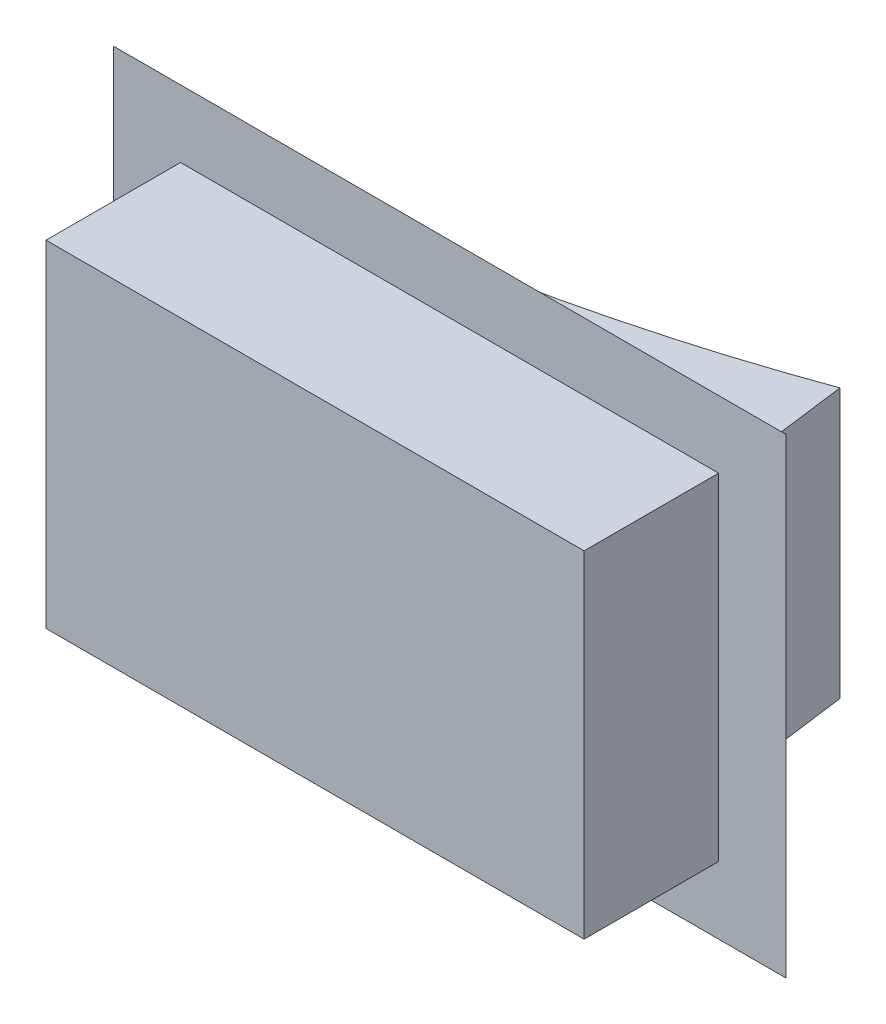
from build123d import *

# Parameters (mm, degrees)
SKETCH1_W           = 20
SKETCH1_H           = 14
BOSS_EXTRUDE1_DEPTH = 2
CHAMFER3_SIZE       = 2
SKETCH2_W           = 14
SKETCH2_H           = 8
BOSS_EXTRUDE2_DEPTH = 3
CUT_EXTRUDE1_DEPTH  = 16.165750888
SKETCH5_W           = 16
SKETCH5_H           = 10
BOSS_EXTRUDE3_DEPTH = 4
SKETCH6_R           = 2.017871448
SKETCH6_R_2         = 1.817871448
SKETCH6_W           = 4.259238865
SKETCH6_H           = 0.3
CUT_EXTRUDE2_DEPTH  = 1.5


with BuildPart() as part:
    # Sketch1 → Boss-Extrude1 (new body)
    with BuildSketch(Plane.XY):
        Rectangle(SKETCH1_W, SKETCH1_H)
    extrude(amount=BOSS_EXTRUDE1_DEPTH)

    # Chamfer3
    chamfer3_edges = [part.edges().sort_by_distance(p)[0] for p in [
        (-10, 0, 0),
        (0, -7, 0),
        (0, 7, 0),
        (10, 0, 0),
    ]]
    chamfer(chamfer3_edges, length=CHAMFER3_SIZE - 0.0001)  # a hair under: the kernel refuses the full size

    # Sketch2 → Boss-Extrude2 (add)
    with BuildSketch(Plane(origin=(0, 0, 0), x_dir=(-1, 0, 0), z_dir=(0, 0, -1))):
        Rectangle(SKETCH2_W, SKETCH2_H)
    extrude(amount=BOSS_EXTRUDE2_DEPTH)

    # Sketch3 → Cut-Extrude1 (cut, through all)
    with BuildSketch(Plane(origin=(0, 4, 0), x_dir=(1, 0, 0), z_dir=(0, 1, 0))):
        with BuildLine():
            add(Edge.make_bspline(
                [(6.607979195, 3), (-0.019315958, 0.580486074), (-7, 0)],
                knots=[0, 0, 0, 1, 1, 1], degree=2))
            Line((6.607979195, 3), (-7, 3))
            Line((-7, 3), (-7, 0))
        make_face()
        Polygon((6.607979195, 3), (7, 0), (7, 3), align=None)
    extrude(amount=-CUT_EXTRUDE1_DEPTH, mode=Mode.SUBTRACT)

    # Sketch5 → Boss-Extrude3 (add)
    with BuildSketch(Plane.XY.offset(2)):
        Rectangle(SKETCH5_W, SKETCH5_H)
    extrude(amount=BOSS_EXTRUDE3_DEPTH)

    # Sketch6 → Cut-Extrude2 (cut)
    # profile 1 of 2: a face of its own
    with BuildSketch(Plane(origin=(6.607979195, -4, -3), x_dir=(-0.9915700128560622, 0, 0.12957202477629515), z_dir=(-0.12957202477629515, 0, -0.9915700128560622))):
        with Locations((3.092933481, 4)):
            Circle(SKETCH6_R)
        with Locations((3.092933481, 4)):
            Circle(SKETCH6_R_2, mode=Mode.SUBTRACT)
    # profile 2 of 2: a face of its own
    with BuildSketch(Plane(origin=(6.607979195, -4, -3), x_dir=(-0.9915700128560622, 0, 0.12957202477629515), z_dir=(-0.12957202477629515, 0, -0.9915700128560622))):
        with Locations((10.0255244, 4)):
            Rectangle(SKETCH6_W, SKETCH6_H)
    extrude(amount=-CUT_EXTRUDE2_DEPTH, mode=Mode.SUBTRACT)


solid = part.part
